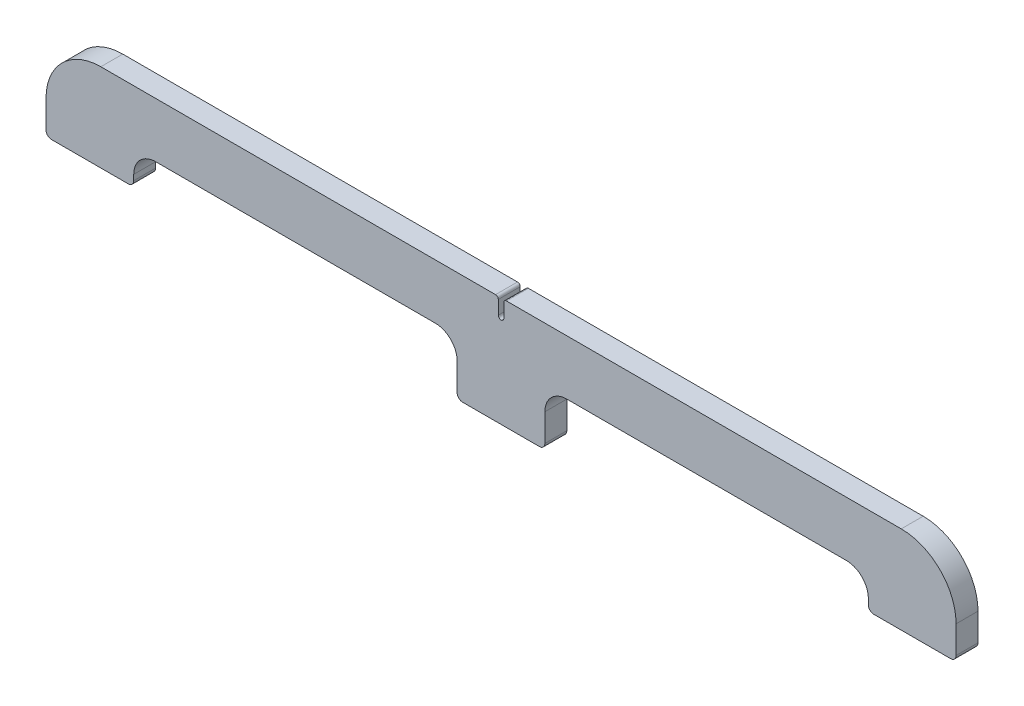
from build123d import *

# Parameters (mm, degrees)
SKETCH1_W           = 25.4
SKETCH1_H           = 6.35
EXTRUDE1_DEPTH      = 131.7625
EXTRUDE2_REACH      = 134.525
FILLET1_R           = 15.875
SKETCH3_W           = 25.4
SKETCH3_H           = 6.35
TAB1_DEPTH          = 6.35
BREAK_CORNER1_START = -3.175
BREAK_CORNER1_DEPTH = 6.35
CUT_EXTRUDE1_REACH  = 135.284
FILLET2_R           = 0.79375


# Read off the part's stored shape, not the designer's step: Break-Corner1
# Sheet-metal steps are written as plain solids
with BuildPart() as part:
    # Sketch1 → Extrude1 (new, symmetric)
    with BuildSketch(Plane.YZ):
        Rectangle(SKETCH1_W, SKETCH1_H)
    extrude(amount=EXTRUDE1_DEPTH, both=True)

    # Sketch2 → Extrude2 (cut, up to next)
    with BuildSketch(Plane.XY.offset(3.175), mode=Mode.PRIVATE) as extrude2_sk1:
        with BuildLine():
            Line((-106.3625, -12.7), (-12.7, -12.7))
            Line((-12.7, -12.7), (-12.7, -9.525))
            ThreePointArc((-12.7, -9.525), (-14.559871939, -5.034871939), (-19.05, -3.175))
            Line((-19.05, -3.175), (-100.0125, -3.175))
            ThreePointArc((-100.0125, -3.175), (-104.502628061, -5.034871939), (-106.3625, -9.525))
            Line((-106.3625, -9.525), (-106.3625, -12.7))
        make_face()
    extrude2_tool1 = extrude(extrude2_sk1.sketch, amount=-EXTRUDE2_REACH, mode=Mode.PRIVATE) & part.part
    # Sketch2 → Extrude2 (cut, up to next)
    with BuildSketch(Plane.XY.offset(3.175), mode=Mode.PRIVATE) as extrude2_sk2:
        with BuildLine():
            Line((12.7, -12.7), (106.3625, -12.7))
            Line((106.3625, -12.7), (106.3625, -9.525))
            ThreePointArc((106.3625, -9.525), (104.502628061, -5.034871939), (100.0125, -3.175))
            Line((100.0125, -3.175), (19.05, -3.175))
            ThreePointArc((19.05, -3.175), (14.559871939, -5.034871939), (12.7, -9.525))
            Line((12.7, -9.525), (12.7, -12.7))
        make_face()
    extrude2_tool2 = extrude(extrude2_sk2.sketch, amount=-EXTRUDE2_REACH, mode=Mode.PRIVATE) & part.part
    add(extrude2_tool1.solids().sort_by_distance((-59.53125, -8.003656, 3.175))[0], mode=Mode.SUBTRACT)
    add(extrude2_tool2.solids().sort_by_distance((59.53125, -8.003656, 3.175))[0], mode=Mode.SUBTRACT)

    # Fillet1
    fillet1_edges = [part.edges().sort_by_distance(p)[0] for p in [
        (131.7625, 12.7, 0),
        (-131.7625, 12.7, 0),
    ]]
    fillet(fillet1_edges, radius=FILLET1_R)

    # Sketch3 → Tab1 (add)
    with BuildSketch(Plane(origin=(0, 0, -3.175), x_dir=(-1, 0, 0), z_dir=(0, 0, -1))):
        with Locations((0, -15.875)):
            Rectangle(SKETCH3_W, SKETCH3_H)
    extrude(amount=-TAB1_DEPTH)

    # Break-Corner1 outline → Break-Corner1 (cut)
    with BuildSketch(Plane.XY.offset(BREAK_CORNER1_START)):
        with BuildLine():
            Line((-131.7625, -12.7), (-130.175, -12.7))
            ThreePointArc((-130.175, -12.7), (-131.297532015, -12.235032015), (-131.7625, -11.1125))
            Line((-131.7625, -11.1125), (-131.7625, -12.7))
        make_face()
        with BuildLine():
            ThreePointArc((-106.3625, -11.1125), (-106.827467985, -12.235032015), (-107.95, -12.7))
            Line((-107.95, -12.7), (-106.3625, -12.7))
            Line((-106.3625, -12.7), (-106.3625, -11.1125))
        make_face()
        with BuildLine():
            ThreePointArc((12.7, -17.4625), (12.235032015, -18.585032015), (11.1125, -19.05))
            Line((11.1125, -19.05), (12.7, -19.05))
            Line((12.7, -19.05), (12.7, -17.4625))
        make_face()
        with BuildLine():
            ThreePointArc((-11.1125, -19.05), (-12.235032015, -18.585032015), (-12.7, -17.4625))
            Line((-12.7, -17.4625), (-12.7, -19.05))
            Line((-12.7, -19.05), (-11.1125, -19.05))
        make_face()
        with BuildLine():
            Line((106.3625, -12.7), (107.95, -12.7))
            ThreePointArc((107.95, -12.7), (106.827467985, -12.235032015), (106.3625, -11.1125))
            Line((106.3625, -11.1125), (106.3625, -12.7))
        make_face()
        with BuildLine():
            ThreePointArc((131.7625, -11.1125), (131.297532015, -12.235032015), (130.175, -12.7))
            Line((130.175, -12.7), (131.7625, -12.7))
            Line((131.7625, -12.7), (131.7625, -11.1125))
        make_face()
    extrude(amount=BREAK_CORNER1_DEPTH, mode=Mode.SUBTRACT)

    # Sketch4 → Cut-Extrude1 (cut, up to next)
    with BuildSketch(Plane(origin=(0, 0, -3.175), x_dir=(-1, 0, 0), z_dir=(0, 0, -1)), mode=Mode.PRIVATE) as cut_extrude1_sk1:
        with BuildLine():
            Line((0.79375, 12.7), (0.79375, 7.9375))
            ThreePointArc((0.79375, 7.9375), (0, 7.14375), (-0.79375, 7.9375))
            Line((-0.79375, 7.9375), (-0.79375, 12.7))
            ThreePointArc((-0.79375, 12.7), (0, 13.49375), (0.79375, 12.7))
        make_face()
    cut_extrude1_tool1 = extrude(cut_extrude1_sk1.sketch, amount=-CUT_EXTRUDE1_REACH, mode=Mode.PRIVATE) & part.part
    add(cut_extrude1_tool1.solids().sort_by_distance((0, 10.31875, -3.175))[0], mode=Mode.SUBTRACT)

    # Fillet2
    fillet2_edges = [part.edges().sort_by_distance(p)[0] for p in [
        (-0.79375, 12.7, 0),
        (0.79375, 12.7, 0),
    ]]
    fillet(fillet2_edges, radius=FILLET2_R)


solid = part.part
